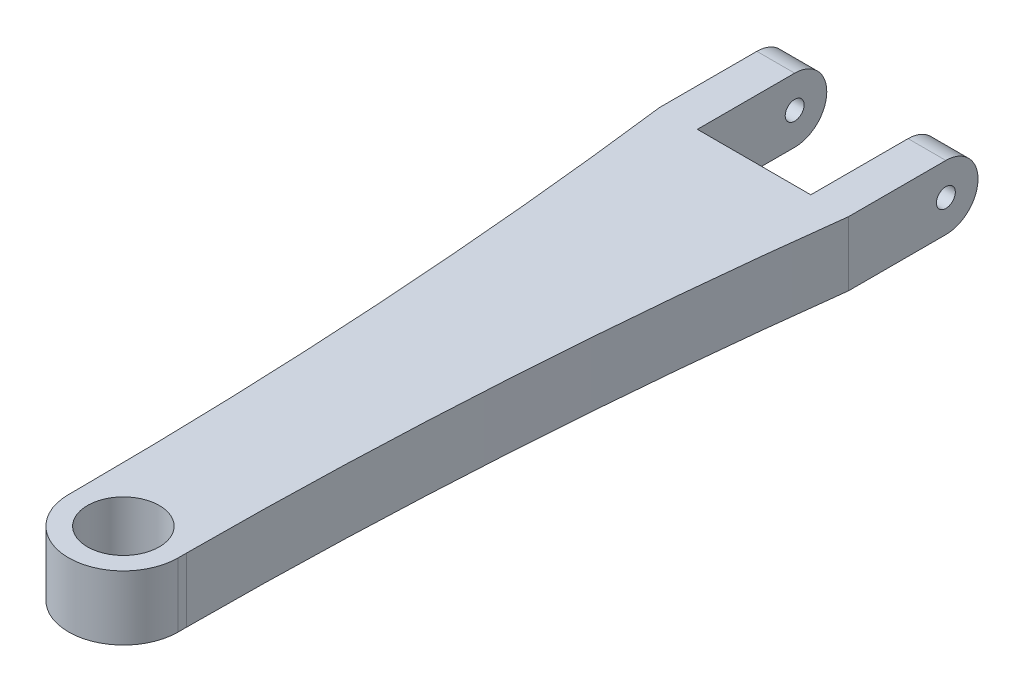
from build123d import *

# Parameters (mm, degrees)
SKETCH1_R               = 12.065
BOSS_EXTRUDE1_DEPTH     = 10.795
SKETCH5_W               = 38.1
SKETCH5_H               = 21.59
BOSS_EXTRUDE2_DEPTH     = 130.488454496
CUT_EXTRUDE2_DEPTH      = 288.61614995
CUT_EXTRUDE2_DEPTH_BACK = 76.454
SKETCH9_W               = 12.7
SKETCH9_H               = 21.59
BOSS_EXTRUDE4_DEPTH     = 117.602
CUT_EXTRUDE3_DEPTH      = 275.951363024
CUT_EXTRUDE3_DEPTH_BACK = 275.951363024
SKETCH6_4_R             = 3.175
CUT_EXTRUDE4_DEPTH      = 259.252608458
SKETCH11_W              = 5.187323944
SKETCH11_H              = 1.989964789
CUT_EXTRUDE7_DEPTH      = 2.54


with BuildPart() as part:
    # Sketch1 → Boss-Extrude1 (new, symmetric)
    with BuildSketch(Plane(origin=(0, 0, 0), x_dir=(1, 0, 0), z_dir=(0, 1, 0))):
        with BuildLine():
            Line((-31.75, 152.4), (31.75, 152.4))
            ThreePointArc((31.75, 152.4), (21.755106695, 76.491146914), (18.415, 0))
            ThreePointArc((18.415, 0), (0, -18.415), (-18.415, 0))
            ThreePointArc((-18.415, 0), (-21.755106695, 76.491146914), (-31.75, 152.4))
        make_face()
        Circle(SKETCH1_R, mode=Mode.SUBTRACT)
    extrude(amount=BOSS_EXTRUDE1_DEPTH, both=True)

    # Sketch5 → Boss-Extrude2 (add)
    with BuildSketch(Plane(origin=(0, 0, -152.4), x_dir=(-1, 0, 0), z_dir=(0, 0, -1))):
        Rectangle(SKETCH5_W, SKETCH5_H)
    extrude(amount=BOSS_EXTRUDE2_DEPTH)

    # Sketch6<3> → Cut-Extrude2 (cut, two sides: drawn at the far end of the back side and taken through both)
    with BuildSketch(Plane(origin=(19.05, 0, 0), x_dir=(0, 0, -1), z_dir=(1, 0, 0)).offset(-CUT_EXTRUDE2_DEPTH_BACK)):
        Polygon((211.893055705, 10.795), (213.781935951, -10.795), (282.888454496, -10.795), (282.888454496, 10.795), align=None)
    extrude(amount=CUT_EXTRUDE2_DEPTH + CUT_EXTRUDE2_DEPTH_BACK, mode=Mode.SUBTRACT)

    # Sketch9 → Boss-Extrude4 (add)
    with BuildSketch(Plane(origin=(0, 0, -152.4), x_dir=(-1, 0, 0), z_dir=(0, 0, -1))):
        with Locations((25.4, 0)):
            Rectangle(SKETCH9_W, SKETCH9_H)
        with Locations((-25.4, 0)):
            Rectangle(SKETCH9_W, SKETCH9_H)
    extrude(amount=BOSS_EXTRUDE4_DEPTH)

    # Sketch6<4> → Cut-Extrude3 (cut, two sides: drawn at the far end of the back side and taken through both)
    with BuildSketch(Plane(origin=(19.05, 0, 0), x_dir=(0, 0, -1), z_dir=(1, 0, 0)).offset(-CUT_EXTRUDE3_DEPTH_BACK)):
        with BuildLine():
            Line((282.888454496, 10.795), (244.587495828, 10.795))
            ThreePointArc((244.587495828, 10.795), (255.382495828, 0), (244.587495828, -10.795))
            Line((244.587495828, -10.795), (282.888454496, -10.795))
            Line((282.888454496, -10.795), (282.888454496, 10.795))
        make_face()
        with Locations((244.587495828, 0)):
            Circle(SKETCH6_4_R)
    extrude(amount=CUT_EXTRUDE3_DEPTH + CUT_EXTRUDE3_DEPTH_BACK, mode=Mode.SUBTRACT)

    # Sketch10 → Cut-Extrude4 (cut, through all)
    with BuildSketch(Plane(origin=(0, 10.795, 0), x_dir=(1, 0, 0), z_dir=(0, 1, 0))):
        with BuildLine():
            Line((-31.75, 211.893055705), (-31.75, 0))
            Line((-31.75, 0), (-18.415, 0))
            ThreePointArc((-18.415, 0), (-21.792855317, 106.153554042), (-31.75, 211.893055705))
        make_face()
        with BuildLine():
            Line((31.75, 0), (18.415, 0))
            ThreePointArc((18.415, 0), (21.792855317, 106.153554042), (31.75, 211.893055705))
            Line((31.75, 211.893055705), (31.75, 0))
        make_face()
    extrude(amount=-CUT_EXTRUDE4_DEPTH, mode=Mode.SUBTRACT)

    # Sketch11 → Cut-Extrude7 (cut)
    # profile 1 of 13: a face of its own
    with BuildSketch(Plane.XZ.offset(10.795)):
        Polygon((-6.35, -62.666908012), (-6.35, -60.341555899), (6.35, -60.341555899), (6.35, -68.393646568), (4.382394366, -68.393646568), (4.382394366, -62.666908012), (1.162676056, -62.666908012), (1.162676056, -67.563562941), (-0.804929577, -67.563562941), (-0.804929577, -62.666908012), align=None)
    # profile 2 of 13: a face of its own
    with BuildSketch(Plane.XZ.offset(10.795)):
        with BuildLine():
            Line((-5.377376761, -75.542986357), (-5.377376761, -75.503857835))
            add(Edge.make_bspline(
                [(-5.377376761, -75.503857835), (-5.523000775, -75.36033513), (-5.741599589, -75.121138963), (-5.993290526, -74.750307116), (-6.188393925, -74.428341526), (-6.343624347, -74.061193712), (-6.499248284, -73.503384161), (-6.522766981, -73.055036767), (-6.528873239, -72.750886885)],
                knots=[0, 0, 0, 0, 0.199682086, 0.314641836, 0.436845726, 0.566325444, 0.702153198, 1, 1, 1, 1], degree=3))
            add(Edge.make_bspline(
                [(-6.528873239, -72.750886885), (-6.534348981, -72.536020084), (-6.500764736, -72.219666618), (-6.425944988, -71.806221024), (-6.337605928, -71.514300981), (-6.230817166, -71.235718964), (-6.094027483, -70.979978414), (-5.945254691, -70.73840068), (-5.766275251, -70.523780442), (-5.571061586, -70.326729325), (-5.35431227, -70.152689964), (-5.118167167, -70.00106113), (-4.863470836, -69.872774179), (-4.591747452, -69.767652732), (-4.198845196, -69.671131267), (-3.891963301, -69.640575015), (-3.683670775, -69.64296435)],
                knots=[0, 0, 0, 0, 0.135753461, 0.201289027, 0.265924895, 0.328744909, 0.390008715, 0.449462135, 0.508198921, 0.566644207, 0.625008926, 0.683964868, 0.744164034, 0.805456281, 0.868173563, 1, 1, 1, 1], degree=3))
            add(Edge.make_bspline(
                [(-3.683670775, -69.64296435), (-3.456156568, -69.643625148), (-3.118669763, -69.671622319), (-2.691839424, -69.789856605), (-2.396678423, -69.910701784), (-2.122840105, -70.062197598), (-1.86870332, -70.239863798), (-1.635436598, -70.443585574), (-1.428372387, -70.678041385), (-1.243818486, -70.936088428), (-1.080730704, -71.217663233), (-0.940530635, -71.523372827), (-0.826895975, -71.853205754), (-0.738826397, -72.204143101), (-0.644561057, -72.705486629), (-0.631020582, -73.096413866), (-0.626056338, -73.360173857)],
                knots=[0, 0, 0, 0, 0.126150634, 0.186107933, 0.24464777, 0.302377155, 0.359057228, 0.416086105, 0.473457026, 0.531873962, 0.591517445, 0.653388754, 0.717839306, 0.784410882, 0.85363079, 1, 1, 1, 1], degree=3))
            add(Edge.make_bspline(
                [(-0.626056338, -73.360173857), (-0.624413187, -73.733158503), (-0.671813539, -74.409193693), (-0.800871678, -75.074085118), (-0.880391725, -75.366908012)],
                knots=[0, 0, 0, 0, 0.551425952, 1, 1, 1, 1], degree=3))
            Line((-0.880391725, -75.366908012), (-0.511465669, -75.366908012))
            add(Edge.make_bspline(
                [(-0.511465669, -75.366908012), (-0.300357842, -75.361455396), (0.022676311, -75.319933432), (0.408452448, -75.127253505), (0.61910918, -74.952385924), (0.767906894, -74.783507968), (0.86463861, -74.633422725), (0.952146934, -74.467158021), (1.027532862, -74.28202301), (1.089389275, -74.076430446), (1.150995481, -73.761993966), (1.161615797, -73.512261395), (1.162676056, -73.340609596)],
                knots=[0, 0, 0, 0, 0.214185065, 0.321340304, 0.430822662, 0.488101748, 0.547781386, 0.610406352, 0.677410811, 0.749051275, 0.826632186, 1, 1, 1, 1], degree=3))
            add(Edge.make_bspline(
                [(1.162676056, -73.340609596), (1.163750396, -72.88474832), (1.103617781, -72.31123122), (0.953794351, -71.629562415), (0.826916507, -71.136220433), (0.712524413, -70.762046259), (0.626056338, -70.509381603)],
                knots=[0, 0, 0, 0, 0.47212599, 0.59466527, 0.723238136, 1, 1, 1, 1], degree=3))
            Line((0.626056338, -70.509381603), (2.333736796, -70.509381603))
            add(Edge.make_bspline(
                [(2.333736796, -70.509381603), (2.536513461, -70.979491858), (2.720634129, -71.600207918), (2.856445509, -72.366637345), (2.930485183, -72.905932424), (2.945548275, -73.318060615), (2.951408451, -73.594944983)],
                knots=[0, 0, 0, 0, 0.484533312, 0.610066216, 0.737401672, 1, 1, 1, 1], degree=3))
            add(Edge.make_bspline(
                [(2.951408451, -73.594944983), (2.954679677, -73.908992017), (2.9240806, -74.366062272), (2.821966282, -74.950634207), (2.716424391, -75.345508895), (2.581176643, -75.707898764), (2.428444071, -76.043141933), (2.245734881, -76.34401221), (2.044212945, -76.616777366), (1.823449811, -76.860217053), (1.577994295, -77.066368928), (1.316722522, -77.24620174), (1.033749136, -77.38737066), (0.735346848, -77.496794385), (0.315470489, -77.602201193), (-0.011714476, -77.633006632), (-0.231976232, -77.633567343)],
                knots=[0, 0, 0, 0, 0.162600675, 0.23662248, 0.307090688, 0.373962725, 0.436786025, 0.497613108, 0.555906724, 0.612258567, 0.667373686, 0.721579263, 0.776178631, 0.830681954, 0.885923677, 1, 1, 1, 1], degree=3))
            Line((-0.231976232, -77.633567343), (-3.652926937, -77.633567343))
            add(Edge.make_bspline(
                [(-3.652926937, -77.633567343), (-3.931528143, -77.629643546), (-4.333955092, -77.637682782), (-4.84918046, -77.643659447), (-5.469716424, -77.660025391), (-5.966205115, -77.678150298), (-6.35, -77.692260124)],
                knots=[0, 0, 0, 0, 0.30976114, 0.447557045, 0.572944586, 1, 1, 1, 1], degree=3))
            Line((-6.35, -77.692260124), (-6.35, -75.638012765))
            Line((-6.35, -75.638012765), (-5.377376761, -75.542986357))
        make_face()
        with BuildLine():
            Line((-3.789876761, -75.366908012), (-2.585277289, -75.366908012))
            add(Edge.make_bspline(
                [(-2.585277289, -75.366908012), (-2.538389902, -75.119504566), (-2.451512268, -74.589476179), (-2.414768227, -74.053185653), (-2.414788732, -73.768228434)],
                knots=[0, 0, 0, 0, 0.469271403, 1, 1, 1, 1], degree=3))
            add(Edge.make_bspline(
                [(-2.414788732, -73.768228434), (-2.416063113, -73.518195998), (-2.443932596, -73.15907743), (-2.570630645, -72.719741368), (-2.702011603, -72.453851668), (-2.868847555, -72.233864724), (-3.162630905, -72.018790386), (-3.438046254, -71.968534831), (-3.619388204, -71.968316462)],
                knots=[0, 0, 0, 0, 0.30772216, 0.439218749, 0.559553598, 0.670424442, 0.775316183, 1, 1, 1, 1], degree=3))
            add(Edge.make_bspline(
                [(-3.619388204, -71.968316462), (-3.790589739, -71.9654023), (-4.042090901, -72.019212147), (-4.315038072, -72.201269389), (-4.474087636, -72.372741573), (-4.594735546, -72.578612909), (-4.712903514, -72.897676082), (-4.738457831, -73.16052626), (-4.740140845, -73.337814702)],
                knots=[0, 0, 0, 0, 0.258055189, 0.374498204, 0.489741314, 0.607497638, 0.731905767, 1, 1, 1, 1], degree=3))
            add(Edge.make_bspline(
                [(-4.740140845, -73.337814702), (-4.742789055, -73.557976374), (-4.694802944, -73.880738366), (-4.556083585, -74.280791136), (-4.431633387, -74.551634364), (-4.283837668, -74.795535263), (-4.083416219, -75.077521193), (-3.906719961, -75.257582978), (-3.789876761, -75.366908012)],
                knots=[0, 0, 0, 0, 0.285977089, 0.420604808, 0.550296036, 0.673226679, 0.791379641, 1, 1, 1, 1], degree=3))
        make_face(mode=Mode.SUBTRACT)
    # profile 3 of 13: a face of its own
    with BuildSketch(Plane.XZ.offset(10.795)):
        with BuildLine():
            Line((-3.736773768, -80.733105195), (0.983802817, -80.733105195))
            Line((0.983802817, -80.733105195), (0.983802817, -79.025424737))
            Line((0.983802817, -79.025424737), (2.772535211, -79.025424737))
            Line((2.772535211, -79.025424737), (2.772535211, -80.733105195))
            Line((2.772535211, -80.733105195), (5.276760563, -80.733105195))
            Line((5.276760563, -80.733105195), (5.276760563, -83.058457307))
            Line((5.276760563, -83.058457307), (2.772535211, -83.058457307))
            Line((2.772535211, -83.058457307), (2.772535211, -85.699632483))
            Line((2.772535211, -85.699632483), (0.983802817, -85.699632483))
            Line((0.983802817, -85.699632483), (0.983802817, -83.058457307))
            Line((0.983802817, -83.058457307), (-3.510387324, -83.058457307))
            add(Edge.make_bspline(
                [(-3.510387324, -83.058457307), (-3.665120027, -83.062913164), (-3.939300523, -83.071184843), (-4.20112758, -83.156748148), (-4.30134243, -83.217766286)],
                knots=[0, 0, 0, 0, 0.571249626, 1, 1, 1, 1], degree=3))
            add(Edge.make_bspline(
                [(-4.30134243, -83.217766286), (-4.376384378, -83.263464438), (-4.474179278, -83.356657263), (-4.573963551, -83.509048884), (-4.63532274, -83.641947847), (-4.683171756, -83.792133253), (-4.727160789, -84.026268266), (-4.743997016, -84.211992105), (-4.740140845, -84.341313821)],
                knots=[0, 0, 0, 0, 0.208419765, 0.317471664, 0.432748722, 0.55639055, 0.692313449, 1, 1, 1, 1], degree=3))
            add(Edge.make_bspline(
                [(-4.740140845, -84.341313821), (-4.738128583, -84.598486376), (-4.698722962, -85.101818338), (-4.585817515, -85.593470433), (-4.522139085, -85.830992519)],
                knots=[0, 0, 0, 0, 0.51106835, 1, 1, 1, 1], degree=3))
            Line((-4.522139085, -85.830992519), (-6.294102113, -85.830992519))
            add(Edge.make_bspline(
                [(-6.294102113, -85.830992519), (-6.376995629, -85.536389773), (-6.489128222, -84.912184346), (-6.524194359, -84.279564169), (-6.528873239, -83.952823504)],
                knots=[0, 0, 0, 0, 0.483324485, 1, 1, 1, 1], degree=3))
            add(Edge.make_bspline(
                [(-6.528873239, -83.952823504), (-6.529403958, -83.598469238), (-6.494139516, -83.084319518), (-6.331754484, -82.445955044), (-6.171130687, -82.036410727), (-5.96339485, -81.681073613), (-5.635638368, -81.280906735), (-5.317751068, -81.062212119), (-5.089502641, -80.959491638)],
                knots=[0, 0, 0, 0, 0.302824136, 0.436649626, 0.560811872, 0.676986647, 0.786518558, 1, 1, 1, 1], degree=3))
            add(Edge.make_bspline(
                [(-5.089502641, -80.959491638), (-4.901931138, -80.878241677), (-4.455217678, -80.754462206), (-3.992371965, -80.735135186), (-3.736773768, -80.733105195)],
                knots=[0, 0, 0, 0, 0.44344314, 1, 1, 1, 1], degree=3))
        make_face()
    # profile 4 of 13: a face of its own
    with BuildSketch(Plane.XZ.offset(10.795)):
        with BuildLine():
            Line((1.528807218, -89.752229314), (1.528807218, -89.791357835))
            add(Edge.make_bspline(
                [(1.528807218, -89.791357835), (1.720760174, -89.935609053), (1.988467231, -90.193516455), (2.310127299, -90.579794212), (2.522445125, -90.919294804), (2.700481841, -91.295655962), (2.894291642, -91.878726633), (2.955362566, -92.355207959), (2.951408451, -92.684073504)],
                knots=[0, 0, 0, 0, 0.214935507, 0.332555904, 0.450128772, 0.573137885, 0.705297303, 1, 1, 1, 1], degree=3))
            add(Edge.make_bspline(
                [(2.951408451, -92.684073504), (2.950327961, -92.981985239), (2.910527196, -93.42633912), (2.756763865, -93.99126285), (2.59610136, -94.386514803), (2.376961496, -94.748930743), (2.010207631, -95.195257769), (1.649328172, -95.453019467), (1.386267606, -95.585173857)],
                knots=[0, 0, 0, 0, 0.257141535, 0.382089427, 0.503852493, 0.623877236, 0.745995042, 1, 1, 1, 1], degree=3))
            add(Edge.make_bspline(
                [(1.386267606, -95.585173857), (1.132236509, -95.711422067), (0.783135498, -95.82641204), (0.337154374, -95.892987032), (-0.028117019, -95.926674219), (-0.314660499, -95.938174374), (-0.514260563, -95.937330547)],
                knots=[0, 0, 0, 0, 0.436009756, 0.559217828, 0.693095009, 1, 1, 1, 1], degree=3))
            Line((-0.514260563, -95.937330547), (-6.35, -95.937330547))
            Line((-6.35, -95.937330547), (-6.35, -93.611978434))
            Line((-6.35, -93.611978434), (-0.757416373, -93.611978434))
            add(Edge.make_bspline(
                [(-0.757416373, -93.611978434), (-0.52662467, -93.609163042), (-0.12943691, -93.608868332), (0.25647615, -93.512271764), (0.405259683, -93.444284772)],
                knots=[0, 0, 0, 0, 0.586908571, 1, 1, 1, 1], degree=3))
            add(Edge.make_bspline(
                [(0.405259683, -93.444284772), (0.533519101, -93.382639677), (0.714162022, -93.269096546), (0.89629601, -93.059997178), (0.997977042, -92.885587831), (1.071614009, -92.695247912), (1.145124592, -92.418656962), (1.16056812, -92.200113776), (1.162676056, -92.052427378)],
                knots=[0, 0, 0, 0, 0.254536988, 0.373413235, 0.491030264, 0.61252201, 0.736173378, 1, 1, 1, 1], degree=3))
            add(Edge.make_bspline(
                [(1.162676056, -92.052427378), (1.158966203, -91.843802346), (1.123054548, -91.531521841), (0.989203271, -91.137811173), (0.85353348, -90.857232566), (0.684776987, -90.586661553), (0.40311117, -90.233888986), (0.146844235, -90.000126183), (-0.039128521, -89.855640406)],
                knots=[0, 0, 0, 0, 0.241565862, 0.359750787, 0.47921944, 0.601148452, 0.727639612, 1, 1, 1, 1], degree=3))
            Line((-0.039128521, -89.855640406), (-6.35, -89.855640406))
            Line((-6.35, -89.855640406), (-6.35, -87.530288293))
            Line((-6.35, -87.530288293), (7.244366197, -87.530288293))
            Line((7.244366197, -87.530288293), (7.244366197, -89.855640406))
            Line((7.244366197, -89.855640406), (3.518772007, -89.855640406))
            add(Edge.make_bspline(
                [(3.518772007, -89.855640406), (3.303621947, -89.851091556), (2.996917187, -89.856224194), (2.60856875, -89.841518229), (2.159094115, -89.829174137), (1.80167679, -89.795959009), (1.528807218, -89.752229314)],
                knots=[0, 0, 0, 0, 0.323698578, 0.461084416, 0.584465162, 1, 1, 1, 1], degree=3))
        make_face()
    # profile 5 of 13: a face of its own
    with BuildSketch(Plane.XZ.offset(10.795)):
        with BuildLine():
            Line((-4.203521127, -105.635613997), (-5.99784331, -105.635613997))
            add(Edge.make_bspline(
                [(-5.99784331, -105.635613997), (-6.077649215, -105.458453484), (-6.167345051, -105.1532888), (-6.278720826, -104.706729941), (-6.362665921, -104.295555802), (-6.438283972, -103.851373346), (-6.508911486, -103.232043995), (-6.527479586, -102.761881255), (-6.528873239, -102.446639526)],
                knots=[0, 0, 0, 0, 0.178834163, 0.293140233, 0.424870548, 0.566116854, 0.708959156, 1, 1, 1, 1], degree=3))
            add(Edge.make_bspline(
                [(-6.528873239, -102.446639526), (-6.524662912, -102.131319639), (-6.502320897, -101.661257984), (-6.393427639, -101.050100669), (-6.29042973, -100.608605375), (-6.149824601, -100.186862328), (-5.967040188, -99.793653518), (-5.748170793, -99.430640857), (-5.49135924, -99.09675923), (-5.194199535, -98.794325863), (-4.855789316, -98.523603419), (-4.475770598, -98.289425087), (-4.056431914, -98.085974661), (-3.591782327, -97.923456074), (-2.885098692, -97.76267825), (-2.322930636, -97.725383297), (-1.936861796, -97.726062941)],
                knots=[0, 0, 0, 0, 0.126201017, 0.187427139, 0.247946949, 0.30730283, 0.364786734, 0.420927941, 0.476423112, 0.53278007, 0.590011285, 0.649225629, 0.710854779, 0.775989482, 0.845550806, 1, 1, 1, 1], degree=3))
            add(Edge.make_bspline(
                [(-1.936861796, -97.726062941), (-1.551391684, -97.723994022), (-0.987743518, -97.766725066), (-0.272258689, -97.921278062), (0.20956217, -98.081777329), (0.649958669, -98.28190242), (1.057402565, -98.505761084), (1.418483701, -98.77135688), (1.741498658, -99.063528971), (2.028737941, -99.379847517), (2.274482595, -99.722079284), (2.484045801, -100.086093475), (2.652541394, -100.471217819), (2.786237314, -100.868759641), (2.915394729, -101.410986904), (2.94915676, -101.827743194), (2.951408451, -102.105662413)],
                knots=[0, 0, 0, 0, 0.156882612, 0.229107997, 0.297459654, 0.36314538, 0.425796905, 0.486323791, 0.545120152, 0.602845335, 0.659887668, 0.716282239, 0.77349699, 0.83069666, 0.886803641, 1, 1, 1, 1], degree=3))
            add(Edge.make_bspline(
                [(2.951408451, -102.105662413), (2.95179406, -102.389056199), (2.920174064, -102.809105834), (2.807204284, -103.350224475), (2.690984536, -103.732202092), (2.535778211, -104.091651112), (2.347359526, -104.430593329), (2.110534971, -104.7383792), (1.843393532, -105.026137305), (1.531440111, -105.281970933), (1.180659459, -105.508434051), (0.788148984, -105.705332363), (0.354268014, -105.868798433), (-0.12072798, -106.000362442), (-0.833428604, -106.13075925), (-1.394858525, -106.1588737), (-1.780347711, -106.161054138)],
                knots=[0, 0, 0, 0, 0.119879172, 0.177458127, 0.233549327, 0.288449864, 0.342803166, 0.397106446, 0.452304595, 0.508563044, 0.567259857, 0.628589586, 0.693946078, 0.763071654, 0.836808316, 1, 1, 1, 1], degree=3))
            add(Edge.make_bspline(
                [(-1.780347711, -106.161054138), (-2.187287943, -106.155119775), (-2.593661972, -106.133105195)],
                knots=[0, 0, 0, 1, 1, 1], degree=2))
            Line((-2.593661972, -106.133105195), (-2.593661972, -99.948003962))
            add(Edge.make_bspline(
                [(-2.593661972, -99.948003962), (-2.774903938, -99.96319537), (-3.037978121, -100.007911676), (-3.367292094, -100.117915981), (-3.585218885, -100.224725812), (-3.783005137, -100.351517662), (-3.96061758, -100.497692237), (-4.11724294, -100.663672035), (-4.25554673, -100.84622579), (-4.372124323, -101.047527348), (-4.477167832, -101.262205722), (-4.559450589, -101.495336489), (-4.700806575, -102.014664254), (-4.73499147, -102.474239762), (-4.740140845, -102.843514526)],
                knots=[0, 0, 0, 0, 0.135126454, 0.197295241, 0.257354931, 0.314959002, 0.371505257, 0.427813743, 0.48416051, 0.541263303, 0.600398386, 0.661490357, 0.724630411, 1, 1, 1, 1], degree=3))
            add(Edge.make_bspline(
                [(-4.740140845, -102.843514526), (-4.737390261, -103.299494273), (-4.633886834, -104.250047657), (-4.365003046, -105.166853639), (-4.203521127, -105.635613997)],
                knots=[0, 0, 0, 0, 0.47870666, 1, 1, 1, 1], degree=3))
        make_face()
        with BuildLine():
            Line((-0.804929577, -100.051415054), (-0.804929577, -103.807753082))
            add(Edge.make_bspline(
                [(-0.804929577, -103.807753082), (-0.54803484, -103.806313397), (-0.164627085, -103.760332842), (0.293592954, -103.564944145), (0.592536635, -103.371466822), (0.836049125, -103.11573763), (0.987888011, -102.859589809), (1.080932495, -102.63422713), (1.144317388, -102.375758748), (1.16637762, -102.173016902), (1.162676056, -102.032995159)],
                knots=[0, 0, 0, 0, 0.25925941, 0.381419877, 0.498352412, 0.614980527, 0.733078308, 0.795710646, 0.859564382, 1, 1, 1, 1], degree=3))
            add(Edge.make_bspline(
                [(1.162676056, -102.032995159), (1.16653727, -101.891968517), (1.143329843, -101.686786946), (1.081139373, -101.42340093), (0.985877416, -101.188317154), (0.837705168, -100.914307595), (0.590400371, -100.637976568), (0.298199411, -100.407902622), (-0.163346474, -100.180612936), (-0.54334646, -100.084247305), (-0.804929577, -100.051415054)],
                knots=[0, 0, 0, 0, 0.136895013, 0.200489877, 0.262829713, 0.383472697, 0.50176953, 0.621370873, 0.743505761, 1, 1, 1, 1], degree=3))
        make_face(mode=Mode.SUBTRACT)
    # profile 6 of 13: a face of its own
    with BuildSketch(Plane.XZ.offset(10.795)):
        with BuildLine():
            Line((1.162676056, -113.623422096), (1.162676056, -113.433369279))
            add(Edge.make_bspline(
                [(1.162676056, -113.433369279), (1.163211888, -113.109248321), (1.122367424, -112.635518596), (0.97443024, -112.03423534), (0.818079731, -111.629751913), (0.62008708, -111.258769861), (0.28935141, -110.819806206), (-0.036534867, -110.56401406), (-0.271104754, -110.426062941)],
                knots=[0, 0, 0, 0, 0.278265096, 0.406110199, 0.53044139, 0.649625591, 0.766089288, 1, 1, 1, 1], degree=3))
            Line((-0.271104754, -110.426062941), (-6.35, -110.426062941))
            Line((-6.35, -110.426062941), (-6.35, -108.100710828))
            Line((-6.35, -108.100710828), (2.772535211, -108.100710828))
            Line((2.772535211, -108.100710828), (2.772535211, -110.029187941))
            Line((2.772535211, -110.029187941), (1.461729754, -110.247189702))
            Line((1.461729754, -110.247189702), (1.461729754, -110.283523328))
            add(Edge.make_bspline(
                [(1.461729754, -110.283523328), (1.68291063, -110.417590265), (2.00580021, -110.644228978), (2.340491022, -111.044331908), (2.561417561, -111.371857259), (2.740165731, -111.737278992), (2.905651094, -112.292439739), (2.953198864, -112.735767779), (2.951408451, -113.039289173)],
                knots=[0, 0, 0, 0, 0.236871689, 0.354320957, 0.473743378, 0.596430905, 0.723496548, 1, 1, 1, 1], degree=3))
            add(Edge.make_bspline(
                [(2.951408451, -113.039289173), (2.954192543, -113.332530441), (2.917869718, -113.623422096)],
                knots=[0, 0, 0, 1, 1, 1], degree=2))
            Line((2.917869718, -113.623422096), (1.162676056, -113.623422096))
        make_face()
    # profile 7 of 13: a face of its own
    with BuildSketch(Plane.XZ.offset(10.795)):
        with BuildLine():
            Line((2.456712148, -121.015917695), (0.626056338, -121.015917695))
            add(Edge.make_bspline(
                [(0.626056338, -121.015917695), (0.70742196, -120.801877229), (0.805100541, -120.466588452), (0.928267125, -120.014657696), (1.001918768, -119.663255254), (1.067169633, -119.313098337), (1.131177006, -118.859054107), (1.165927562, -118.521287864), (1.162676056, -118.299280371)],
                knots=[0, 0, 0, 0, 0.246773815, 0.376734394, 0.505287754, 0.634041406, 0.760993002, 1, 1, 1, 1], degree=3))
            add(Edge.make_bspline(
                [(1.162676056, -118.299280371), (1.162967774, -118.075256241), (1.136820421, -117.760242528), (1.012794305, -117.391006359), (0.899741998, -117.189939245), (0.765004101, -117.034429322), (0.553627085, -116.90571075), (0.376546734, -116.865982734), (0.259925176, -116.865499561)],
                knots=[0, 0, 0, 0, 0.355425938, 0.494403848, 0.613294326, 0.718739884, 0.816122949, 1, 1, 1, 1], degree=3))
            add(Edge.make_bspline(
                [(0.259925176, -116.865499561), (0.165168783, -116.862313852), (0.028558931, -116.882817382), (-0.139270757, -116.948033898), (-0.281405491, -117.043755316), (-0.434250809, -117.210627276), (-0.56818338, -117.461484516), (-0.671229832, -117.744759072), (-0.792230798, -118.136759867), (-0.860541914, -118.43777364), (-0.913930458, -118.634667695)],
                knots=[0, 0, 0, 0, 0.12262133, 0.177451452, 0.232494819, 0.343785443, 0.467317434, 0.599463407, 0.734963276, 1, 1, 1, 1], degree=3))
            add(Edge.make_bspline(
                [(-0.913930458, -118.634667695), (-0.992176085, -118.93811864), (-1.117371574, -119.389734115), (-1.358288596, -119.965010572), (-1.573327491, -120.285948213), (-1.774779065, -120.517399031), (-1.950728796, -120.671507791), (-2.146424733, -120.810950863), (-2.363118713, -120.935695405), (-2.605892376, -121.038951434), (-2.989657989, -121.132357222), (-3.296479847, -121.161218617), (-3.510387324, -121.158457307)],
                knots=[0, 0, 0, 0, 0.235459101, 0.351725582, 0.466842381, 0.523864189, 0.58187405, 0.642084369, 0.704157612, 0.769412783, 0.839524744, 1, 1, 1, 1], degree=3))
            add(Edge.make_bspline(
                [(-3.510387324, -121.158457307), (-3.75084684, -121.159488507), (-4.103293863, -121.122088088), (-4.546993085, -120.993947425), (-4.844845152, -120.857924475), (-5.118979383, -120.68873592), (-5.367640133, -120.486577621), (-5.593568195, -120.254856856), (-5.794957784, -119.99406032), (-5.971005507, -119.704891362), (-6.121605363, -119.389610946), (-6.250094343, -119.051348869), (-6.353709493, -118.68948228), (-6.428804763, -118.307529), (-6.511458109, -117.76765445), (-6.52731177, -117.351124884), (-6.528873239, -117.06952685)],
                knots=[0, 0, 0, 0, 0.125855407, 0.184365257, 0.24113851, 0.296787386, 0.352641216, 0.40853552, 0.46591976, 0.524828999, 0.585494137, 0.648652749, 0.71413013, 0.782354753, 0.852390659, 1, 1, 1, 1], degree=3))
            add(Edge.make_bspline(
                [(-6.528873239, -117.06952685), (-6.532256341, -116.79412022), (-6.5096232, -116.391864344), (-6.455740299, -115.870781473), (-6.393787706, -115.513659161), (-6.31730915, -115.18349907), (-6.216884552, -114.795939895), (-6.115667331, -114.52703769), (-6.039766725, -114.361274209)],
                knots=[0, 0, 0, 0, 0.297874603, 0.435855396, 0.566829643, 0.689885267, 0.802655885, 1, 1, 1, 1], degree=3))
            Line((-6.039766725, -114.361274209), (-4.203521127, -114.361274209))
            add(Edge.make_bspline(
                [(-4.203521127, -114.361274209), (-4.30229691, -114.592359859), (-4.42767227, -114.937101764), (-4.560665316, -115.393637599), (-4.690532258, -115.992947042), (-4.73657351, -116.490744556), (-4.740140845, -116.879474033)],
                knots=[0, 0, 0, 0, 0.290731084, 0.424175831, 0.55001595, 1, 1, 1, 1], degree=3))
            add(Edge.make_bspline(
                [(-4.740140845, -116.879474033), (-4.739864024, -117.138235234), (-4.719095616, -117.512535938), (-4.614518171, -117.977596059), (-4.501526791, -118.265775544), (-4.352568503, -118.504040894), (-4.196956622, -118.660769792), (-4.055457836, -118.753113155), (-3.894260352, -118.812105643), (-3.766979377, -118.837716833), (-3.678080986, -118.833105195)],
                knots=[0, 0, 0, 0, 0.314780777, 0.453182003, 0.57763785, 0.689127118, 0.792398441, 0.843280849, 0.893106937, 1, 1, 1, 1], degree=3))
            add(Edge.make_bspline(
                [(-3.678080986, -118.833105195), (-3.590103611, -118.829382596), (-3.458202008, -118.818006313), (-3.301962904, -118.747749422), (-3.168451666, -118.649246762), (-3.019182206, -118.48942983), (-2.882998151, -118.245042155), (-2.766914491, -117.961451758), (-2.635053279, -117.520515423), (-2.546772299, -117.17379688), (-2.487455986, -116.93537192)],
                knots=[0, 0, 0, 0, 0.110146159, 0.160863683, 0.210596307, 0.315300106, 0.429325168, 0.555802258, 0.695135189, 1, 1, 1, 1], degree=3))
            add(Edge.make_bspline(
                [(-2.487455986, -116.93537192), (-2.394926348, -116.631391227), (-2.264866356, -116.177001962), (-1.998987123, -115.619364833), (-1.785729579, -115.315069226), (-1.586323026, -115.103649842), (-1.419323665, -114.960970098), (-1.23265389, -114.83797023), (-1.029562842, -114.729941742), (-0.804156785, -114.642148841), (-0.457776037, -114.558826866), (-0.181527462, -114.53905451), (0.008384683, -114.540147448)],
                knots=[0, 0, 0, 0, 0.251385219, 0.371833556, 0.48637374, 0.543110701, 0.601056372, 0.659425673, 0.719333199, 0.782466506, 0.849928472, 1, 1, 1, 1], degree=3))
            add(Edge.make_bspline(
                [(0.008384683, -114.540147448), (0.243855212, -114.544504521), (0.593008794, -114.568139772), (1.026428884, -114.699822343), (1.317536944, -114.830070775), (1.584268692, -114.989425028), (1.825633798, -115.178947027), (2.045346309, -115.391487798), (2.238095045, -115.63138493), (2.408324496, -115.890752471), (2.554426522, -116.170057664), (2.677046916, -116.466817896), (2.776869512, -116.779293277), (2.854542906, -117.102631739), (2.929894148, -117.546309301), (2.951134512, -117.885031873), (2.951408451, -118.112022448)],
                knots=[0, 0, 0, 0, 0.136322678, 0.199738465, 0.260360244, 0.319898052, 0.378484798, 0.437009893, 0.495845051, 0.555615241, 0.615710696, 0.677388038, 0.740609979, 0.804739025, 0.869056938, 1, 1, 1, 1], degree=3))
            add(Edge.make_bspline(
                [(2.951408451, -118.112022448), (2.950176842, -118.383274234), (2.938285967, -118.785561137), (2.875870757, -119.310179181), (2.818298638, -119.68427229), (2.74500935, -120.042065153), (2.635973149, -120.487915027), (2.534857703, -120.810016077), (2.456712148, -121.015917695)],
                knots=[0, 0, 0, 0, 0.274971999, 0.407041084, 0.535068094, 0.658355187, 0.776942064, 1, 1, 1, 1], degree=3))
        make_face()
    # profile 8 of 13: a face of its own
    with BuildSketch(Plane.XZ.offset(10.795)):
        with BuildLine():
            Line((-6.35, -127.240147448), (6.35, -127.240147448))
            Line((6.35, -127.240147448), (6.35, -130.649918575))
            add(Edge.make_bspline(
                [(6.35, -130.649918575), (6.352401126, -130.957614184), (6.336067674, -131.41937187), (6.288709701, -132.030393899), (6.237999682, -132.478579326), (6.176990552, -132.914081917), (6.08055871, -133.457144278), (5.985106358, -133.851892678), (5.902816901, -134.101613117)],
                knots=[0, 0, 0, 0, 0.264241714, 0.396690221, 0.526331298, 0.651611411, 0.7743639, 1, 1, 1, 1], degree=3))
            add(Edge.make_bspline(
                [(5.902816901, -134.101613117), (5.795136142, -134.430981425), (5.619127947, -134.915399707), (5.297106232, -135.50955694), (5.038468563, -135.922519442), (4.75028627, -136.303078649), (4.435449417, -136.651159253), (4.097200814, -136.968693698), (3.731692971, -137.250713418), (3.345754748, -137.504026009), (2.935761758, -137.720933099), (2.506143178, -137.910840764), (2.05293437, -138.062831059), (1.579601975, -138.184447748), (0.91072037, -138.294838363), (0.39635123, -138.333425524), (0.047513204, -138.330288293)],
                knots=[0, 0, 0, 0, 0.133631804, 0.197502107, 0.259897886, 0.321093303, 0.381029999, 0.440416757, 0.499467825, 0.558565721, 0.617941645, 0.677854723, 0.739222309, 0.801774613, 0.865816925, 1, 1, 1, 1], degree=3))
            add(Edge.make_bspline(
                [(0.047513204, -138.330288293), (-0.28430138, -138.333840239), (-0.775276696, -138.299241914), (-1.416384532, -138.208588751), (-1.873991432, -138.10707874), (-2.313473992, -137.976524072), (-2.73338197, -137.813417744), (-3.135027968, -137.623509297), (-3.516077437, -137.402679836), (-3.875336197, -137.149255695), (-4.214501549, -136.866836353), (-4.531049622, -136.55227955), (-4.825410244, -136.207966025), (-5.095333755, -135.830070995), (-5.428594365, -135.273156428), (-5.627860652, -134.818430385), (-5.743507923, -134.504077906)],
                knots=[0, 0, 0, 0, 0.133477506, 0.197937946, 0.260560077, 0.32204026, 0.382372043, 0.441774098, 0.50077679, 0.559476979, 0.618604762, 0.67829044, 0.738959515, 0.80079804, 0.865070446, 1, 1, 1, 1], degree=3))
            add(Edge.make_bspline(
                [(-5.743507923, -134.504077906), (-5.850539013, -134.218443633), (-5.983589514, -133.769068765), (-6.11732505, -133.144049711), (-6.204290199, -132.636982176), (-6.272106614, -132.098996611), (-6.328469378, -131.317893833), (-6.3552807, -130.715650757), (-6.35, -130.303351673)],
                knots=[0, 0, 0, 0, 0.214411906, 0.329042931, 0.44935998, 0.576136384, 0.710206617, 1, 1, 1, 1], degree=3))
            Line((-6.35, -130.303351673), (-6.35, -127.240147448))
        make_face()
        with BuildLine():
            Line((4.382394366, -130.599610476), (4.382394366, -129.565499561))
            Line((4.382394366, -129.565499561), (-4.382394366, -129.565499561))
            Line((-4.382394366, -129.565499561), (-4.382394366, -130.532533012))
            add(Edge.make_bspline(
                [(-4.382394366, -130.532533012), (-4.381151344, -130.856860357), (-4.370179064, -131.330666707), (-4.30834894, -131.941446242), (-4.24749011, -132.358453879), (-4.170309251, -132.746905477), (-4.046293589, -133.214008975), (-3.92650113, -133.544787375), (-3.826210387, -133.749456427)],
                knots=[0, 0, 0, 0, 0.295852076, 0.431605319, 0.559553661, 0.680006576, 0.792513711, 1, 1, 1, 1], degree=3))
            add(Edge.make_bspline(
                [(-3.826210387, -133.749456427), (-3.748184803, -133.918280698), (-3.604162615, -134.15363389), (-3.391610362, -134.450403216), (-3.2143538, -134.650198978), (-3.026113064, -134.837632244), (-2.821428749, -135.006248106), (-2.6060123, -135.165453008), (-2.373160336, -135.304052894), (-2.12539126, -135.429212992), (-1.859522141, -135.532773703), (-1.579804582, -135.627667734), (-1.281663975, -135.697580232), (-0.96881872, -135.758503089), (-0.51736888, -135.808285352), (-0.170076847, -135.827577623), (0.067077465, -135.826062941)],
                knots=[0, 0, 0, 0, 0.118882575, 0.176559242, 0.233677013, 0.28982555, 0.346621035, 0.403463569, 0.461313013, 0.520052101, 0.581138163, 0.644007041, 0.70916716, 0.777198731, 0.848141293, 1, 1, 1, 1], degree=3))
            add(Edge.make_bspline(
                [(0.067077465, -135.826062941), (0.313360434, -135.823980003), (0.674483909, -135.808544259), (1.139972056, -135.736043727), (1.461074314, -135.660390945), (1.766300842, -135.565737948), (2.051640484, -135.447273145), (2.323826312, -135.316993306), (2.575797925, -135.162248586), (2.809477116, -134.98800519), (3.030444927, -134.801690379), (3.228291314, -134.591868522), (3.413763779, -134.368853981), (3.581022726, -134.127950062), (3.784256623, -133.78336948), (3.914206075, -133.509877701), (3.985519366, -133.319042695)],
                knots=[0, 0, 0, 0, 0.148227475, 0.216860422, 0.283052715, 0.346498398, 0.408828175, 0.468722568, 0.527825371, 0.586327452, 0.64394532, 0.701410398, 0.759524758, 0.818283898, 0.877577647, 1, 1, 1, 1], degree=3))
            add(Edge.make_bspline(
                [(3.985519366, -133.319042695), (4.132989275, -132.926965697), (4.254799075, -132.403380049), (4.331799991, -131.750824137), (4.374812599, -131.24989279), (4.381166666, -130.863300936), (4.382394366, -130.599610476)],
                knots=[0, 0, 0, 0, 0.454150206, 0.580522118, 0.713528149, 1, 1, 1, 1], degree=3))
        make_face(mode=Mode.SUBTRACT)
    # profile 9 of 13: a face of its own
    with BuildSketch(Plane.XZ.offset(10.795)):
        with BuildLine():
            Line((-5.377376761, -145.661296216), (-5.377376761, -145.622167695))
            add(Edge.make_bspline(
                [(-5.377376761, -145.622167695), (-5.523000775, -145.478644989), (-5.741599589, -145.239448822), (-5.993290526, -144.868616975), (-6.188393925, -144.546651385), (-6.343624347, -144.179503571), (-6.499248284, -143.62169402), (-6.522766981, -143.173346626), (-6.528873239, -142.869196744)],
                knots=[0, 0, 0, 0, 0.199682086, 0.314641836, 0.436845726, 0.566325444, 0.702153198, 1, 1, 1, 1], degree=3))
            add(Edge.make_bspline(
                [(-6.528873239, -142.869196744), (-6.534348981, -142.654329943), (-6.500764736, -142.337976478), (-6.425944988, -141.924530883), (-6.337605928, -141.63261084), (-6.230817166, -141.354028823), (-6.094027483, -141.098288273), (-5.945254691, -140.856710539), (-5.766275251, -140.642090301), (-5.571061586, -140.445039184), (-5.35431227, -140.270999823), (-5.118167167, -140.119370989), (-4.863470836, -139.991084038), (-4.591747452, -139.885962591), (-4.198845196, -139.789441126), (-3.891963301, -139.758884874), (-3.683670775, -139.761274209)],
                knots=[0, 0, 0, 0, 0.135753461, 0.201289027, 0.265924895, 0.328744909, 0.390008715, 0.449462135, 0.508198921, 0.566644207, 0.625008926, 0.683964868, 0.744164034, 0.805456281, 0.868173563, 1, 1, 1, 1], degree=3))
            add(Edge.make_bspline(
                [(-3.683670775, -139.761274209), (-3.456156568, -139.761935007), (-3.118669763, -139.789932178), (-2.691839424, -139.908166464), (-2.396678423, -140.029011644), (-2.122840105, -140.180507457), (-1.86870332, -140.358173657), (-1.635436598, -140.561895433), (-1.428372387, -140.796351244), (-1.243818486, -141.054398287), (-1.080730704, -141.335973092), (-0.940530635, -141.641682686), (-0.826895975, -141.971515613), (-0.738826397, -142.32245296), (-0.644561057, -142.823796488), (-0.631020582, -143.214723726), (-0.626056338, -143.478483716)],
                knots=[0, 0, 0, 0, 0.126150634, 0.186107933, 0.24464777, 0.302377155, 0.359057228, 0.416086105, 0.473457026, 0.531873962, 0.591517445, 0.653388754, 0.717839306, 0.784410882, 0.85363079, 1, 1, 1, 1], degree=3))
            add(Edge.make_bspline(
                [(-0.626056338, -143.478483716), (-0.624413187, -143.851468363), (-0.671813539, -144.527503552), (-0.800871678, -145.192394977), (-0.880391725, -145.485217871)],
                knots=[0, 0, 0, 0, 0.551425952, 1, 1, 1, 1], degree=3))
            Line((-0.880391725, -145.485217871), (-0.511465669, -145.485217871))
            add(Edge.make_bspline(
                [(-0.511465669, -145.485217871), (-0.300357842, -145.479765255), (0.022676311, -145.438243291), (0.408452448, -145.245563364), (0.61910918, -145.070695783), (0.767906894, -144.901817827), (0.86463861, -144.751732584), (0.952146934, -144.58546788), (1.027532862, -144.400332869), (1.089389275, -144.194740305), (1.150995481, -143.880303825), (1.161615797, -143.630571254), (1.162676056, -143.458919455)],
                knots=[0, 0, 0, 0, 0.214185065, 0.321340304, 0.430822662, 0.488101748, 0.547781386, 0.610406352, 0.677410811, 0.749051275, 0.826632186, 1, 1, 1, 1], degree=3))
            add(Edge.make_bspline(
                [(1.162676056, -143.458919455), (1.163750396, -143.003058179), (1.103617781, -142.429541079), (0.953794351, -141.747872274), (0.826916507, -141.254530292), (0.712524413, -140.880356119), (0.626056338, -140.627691462)],
                knots=[0, 0, 0, 0, 0.47212599, 0.59466527, 0.723238136, 1, 1, 1, 1], degree=3))
            Line((0.626056338, -140.627691462), (2.333736796, -140.627691462))
            add(Edge.make_bspline(
                [(2.333736796, -140.627691462), (2.536513461, -141.097801718), (2.720634129, -141.718517777), (2.856445509, -142.484947204), (2.930485183, -143.024242283), (2.945548275, -143.436370475), (2.951408451, -143.713254843)],
                knots=[0, 0, 0, 0, 0.484533312, 0.610066216, 0.737401672, 1, 1, 1, 1], degree=3))
            add(Edge.make_bspline(
                [(2.951408451, -143.713254843), (2.954679677, -144.027301876), (2.9240806, -144.484372131), (2.821966282, -145.068944066), (2.716424391, -145.463818754), (2.581176643, -145.826208623), (2.428444071, -146.161451792), (2.245734881, -146.46232207), (2.044212945, -146.735087226), (1.823449811, -146.978526912), (1.577994295, -147.184678787), (1.316722522, -147.364511599), (1.033749136, -147.505680519), (0.735346848, -147.615104244), (0.315470489, -147.720511052), (-0.011714476, -147.751316492), (-0.231976232, -147.751877202)],
                knots=[0, 0, 0, 0, 0.162600675, 0.23662248, 0.307090688, 0.373962725, 0.436786025, 0.497613108, 0.555906724, 0.612258567, 0.667373686, 0.721579263, 0.776178631, 0.830681954, 0.885923677, 1, 1, 1, 1], degree=3))
            Line((-0.231976232, -147.751877202), (-3.652926937, -147.751877202))
            add(Edge.make_bspline(
                [(-3.652926937, -147.751877202), (-3.931528143, -147.747953405), (-4.333955092, -147.755992641), (-4.84918046, -147.761969306), (-5.469716424, -147.77833525), (-5.966205115, -147.796460158), (-6.35, -147.810569983)],
                knots=[0, 0, 0, 0, 0.30976114, 0.447557045, 0.572944586, 1, 1, 1, 1], degree=3))
            Line((-6.35, -147.810569983), (-6.35, -145.756322624))
            Line((-6.35, -145.756322624), (-5.377376761, -145.661296216))
        make_face()
        with BuildLine():
            Line((-3.789876761, -145.485217871), (-2.585277289, -145.485217871))
            add(Edge.make_bspline(
                [(-2.585277289, -145.485217871), (-2.538389902, -145.237814426), (-2.451512268, -144.707786038), (-2.414768227, -144.171495512), (-2.414788732, -143.886538293)],
                knots=[0, 0, 0, 0, 0.469271403, 1, 1, 1, 1], degree=3))
            add(Edge.make_bspline(
                [(-2.414788732, -143.886538293), (-2.416063113, -143.636505858), (-2.443932596, -143.277387289), (-2.570630645, -142.838051227), (-2.702011603, -142.572161527), (-2.868847555, -142.352174584), (-3.162630905, -142.137100245), (-3.438046254, -142.08684469), (-3.619388204, -142.086626321)],
                knots=[0, 0, 0, 0, 0.30772216, 0.439218749, 0.559553598, 0.670424442, 0.775316183, 1, 1, 1, 1], degree=3))
            add(Edge.make_bspline(
                [(-3.619388204, -142.086626321), (-3.790589739, -142.08371216), (-4.042090901, -142.137522006), (-4.315038072, -142.319579248), (-4.474087636, -142.491051432), (-4.594735546, -142.696922768), (-4.712903514, -143.015985941), (-4.738457831, -143.278836119), (-4.740140845, -143.456124561)],
                knots=[0, 0, 0, 0, 0.258055189, 0.374498204, 0.489741314, 0.607497638, 0.731905767, 1, 1, 1, 1], degree=3))
            add(Edge.make_bspline(
                [(-4.740140845, -143.456124561), (-4.742789055, -143.676286233), (-4.694802944, -143.999048225), (-4.556083585, -144.399100996), (-4.431633387, -144.669944224), (-4.283837668, -144.913845122), (-4.083416219, -145.195831052), (-3.906719961, -145.375892837), (-3.789876761, -145.485217871)],
                knots=[0, 0, 0, 0, 0.285977089, 0.420604808, 0.550296036, 0.673226679, 0.791379641, 1, 1, 1, 1], degree=3))
        make_face(mode=Mode.SUBTRACT)
    # profile 10 of 13: a face of its own
    with BuildSketch(Plane.XZ.offset(10.795)):
        with BuildLine():
            Line((2.772535211, -149.157709068), (2.772535211, -151.55293354))
            Line((2.772535211, -151.55293354), (-0.556183979, -152.919636885))
            add(Edge.make_bspline(
                [(-0.556183979, -152.919636885), (-0.849648961, -153.043517817), (-1.27954096, -153.210183857), (-1.827699662, -153.433870629), (-2.195376724, -153.574340255), (-2.529190983, -153.707921655), (-2.91598896, -153.850427085), (-3.188118759, -153.956739602), (-3.362257923, -154.015235476)],
                knots=[0, 0, 0, 0, 0.317162276, 0.459116747, 0.589534284, 0.709096041, 0.817135503, 1, 1, 1, 1], degree=3))
            Line((-3.362257923, -154.015235476), (-3.362257923, -154.051569103))
            add(Edge.make_bspline(
                [(-3.362257923, -154.051569103), (-3.218060041, -154.099788595), (-2.983120962, -154.183229278), (-2.64530951, -154.30729182), (-2.335022971, -154.424583484), (-1.987785813, -154.560907688), (-1.444597484, -154.764112869), (-1.023068041, -154.93843886), (-0.726672535, -155.052141286)],
                knots=[0, 0, 0, 0, 0.161778826, 0.265275005, 0.382924346, 0.514735512, 0.662204866, 1, 1, 1, 1], degree=3))
            Line((-0.726672535, -155.052141286), (2.772535211, -156.466357835))
            Line((2.772535211, -156.466357835), (2.772535211, -158.892326145))
            Line((2.772535211, -158.892326145), (-10.821830986, -153.00627861))
            Line((-10.821830986, -153.00627861), (-10.821830986, -150.798312061))
            Line((-10.821830986, -150.798312061), (-5.902816901, -152.891687941))
            Line((-5.902816901, -152.891687941), (2.772535211, -149.157709068))
        make_face()
    # profile 11 of 13: a face of its own
    with BuildSketch(Plane.XZ.offset(10.795)):
        with Locations((3.756338028, -165.04668354)):
            Rectangle(SKETCH11_W, SKETCH11_H)
    # profile 12 of 13: a face of its own
    with BuildSketch(Plane.XZ.offset(10.795)):
        Polygon((-4.382394366, -171.24296435), (0.410849472, -171.24296435), (-0.494696303, -168.065169455), (1.472909331, -168.065169455), (2.772535211, -171.782378962), (2.772535211, -173.568316462), (-4.382394366, -173.568316462), (-4.382394366, -176.229055899), (-6.35, -176.229055899), (-6.35, -168.252427378), (-4.382394366, -168.252427378), align=None)
    # profile 13 of 13: a face of its own
    with BuildSketch(Plane.XZ.offset(10.795)):
        with BuildLine():
            Line((-4.552882923, -184.057555019), (-4.552882923, -184.018426497))
            add(Edge.make_bspline(
                [(-4.552882923, -184.018426497), (-4.647781632, -183.851026394), (-4.762037725, -183.579497355), (-4.887742905, -183.198885445), (-5.046175319, -182.56275831), (-5.097866977, -182.007851479), (-5.097887324, -181.56171435)],
                knots=[0, 0, 0, 0, 0.226681694, 0.347026031, 0.472936203, 1, 1, 1, 1], degree=3))
            add(Edge.make_bspline(
                [(-5.097887324, -181.56171435), (-5.101639306, -181.285569479), (-5.067420964, -180.877191811), (-4.967085248, -180.346736607), (-4.860523939, -179.968962939), (-4.725922672, -179.609352744), (-4.5562237, -179.273558434), (-4.357332334, -178.963012044), (-4.130921003, -178.675282215), (-3.870619803, -178.417304901), (-3.584104675, -178.183702099), (-3.263296201, -177.986504895), (-2.91991851, -177.809644946), (-2.542889047, -177.674536351), (-1.991187795, -177.535219207), (-1.554027165, -177.504583675), (-1.257702465, -177.50352773)],
                knots=[0, 0, 0, 0, 0.131271095, 0.194486545, 0.256667354, 0.31784905, 0.376937001, 0.435357479, 0.493106172, 0.550791856, 0.609440697, 0.6686101, 0.729680847, 0.792939817, 0.858749862, 1, 1, 1, 1], degree=3))
            add(Edge.make_bspline(
                [(-1.257702465, -177.50352773), (-0.968240765, -177.500221565), (-0.540699055, -177.538499217), (0.011589418, -177.658847031), (0.40269925, -177.784635517), (0.773934325, -177.944016359), (1.124101291, -178.132691726), (1.443165263, -178.363169052), (1.74171937, -178.619449095), (2.010551206, -178.911372706), (2.248551736, -179.235694387), (2.460638608, -179.588898351), (2.634541016, -179.976141499), (2.780057517, -180.391186035), (2.914111846, -181.001282218), (2.953691714, -181.478990348), (2.951408451, -181.804870159)],
                knots=[0, 0, 0, 0, 0.128047653, 0.189298167, 0.2499569, 0.309644331, 0.367979475, 0.425664941, 0.483560919, 0.541942713, 0.600930478, 0.66141505, 0.7239902, 0.788561962, 0.855808242, 1, 1, 1, 1], degree=3))
            add(Edge.make_bspline(
                [(2.951408451, -181.804870159), (2.948144854, -182.159147544), (2.911652604, -182.682496443), (2.738025692, -183.342072045), (2.565160206, -183.792994936), (2.341476299, -184.209224775), (2.076412608, -184.595505726), (1.759348312, -184.943447893), (1.399914836, -185.258411002), (0.994214909, -185.536138382), (0.543394669, -185.776158973), (0.049600704, -185.983457054), (-0.488720702, -186.15243858), (-1.067971713, -186.286268292), (-1.918953519, -186.415522424), (-2.5818026, -186.44515802), (-3.035255282, -186.447189702)],
                knots=[0, 0, 0, 0, 0.123958862, 0.181797435, 0.237620103, 0.292197499, 0.346433507, 0.400792311, 0.456123677, 0.51297301, 0.572066935, 0.634178557, 0.699716825, 0.768845064, 0.841586884, 1, 1, 1, 1], degree=3))
            add(Edge.make_bspline(
                [(-3.035255282, -186.447189702), (-3.662438798, -186.448202305), (-4.442818587, -186.393670845), (-5.357197997, -186.236530994), (-5.794034755, -186.138490305), (-6.215979629, -186.017922791), (-6.626652685, -185.882117696), (-7.020017104, -185.722217028), (-7.3995701, -185.543367619), (-7.760926801, -185.342183668), (-8.107011981, -185.124419079), (-8.43272073, -184.884186771), (-8.734515624, -184.617536865), (-9.014990622, -184.329717641), (-9.270740018, -184.017782832), (-9.500818659, -183.681687064), (-9.701882551, -183.320119489), (-9.87529405, -182.934485219), (-10.024433867, -182.526006829), (-10.141843986, -182.091370585), (-10.255642206, -181.463333279), (-10.284880228, -180.974716772), (-10.285211268, -180.642194103)],
                knots=[0, 0, 0, 0, 0.178979021, 0.222420745, 0.264662452, 0.306654992, 0.347594313, 0.388023833, 0.427740024, 0.467244803, 0.505962704, 0.544349744, 0.582586454, 0.620749165, 0.658905395, 0.69754199, 0.73681443, 0.776789558, 0.818079514, 0.860769697, 0.905089918, 1, 1, 1, 1], degree=3))
            add(Edge.make_bspline(
                [(-10.285211268, -180.642194103), (-10.288803118, -180.380718108), (-10.265406789, -179.993797683), (-10.202227016, -179.486367397), (-10.13643371, -179.122075277), (-10.048599633, -178.773830504), (-9.92038691, -178.343481242), (-9.790345771, -178.040314997), (-9.692693662, -177.850094631)],
                knots=[0, 0, 0, 0, 0.272189035, 0.403275266, 0.532523681, 0.657508128, 0.77723523, 1, 1, 1, 1], degree=3))
            Line((-9.692693662, -177.850094631), (-7.702728873, -177.850094631))
            add(Edge.make_bspline(
                [(-7.702728873, -177.850094631), (-7.807128548, -178.054674331), (-7.936043996, -178.3760715), (-8.078734936, -178.817745222), (-8.16407195, -179.158829858), (-8.228785959, -179.498903005), (-8.298567325, -179.931617241), (-8.313540919, -180.253457824), (-8.317605634, -180.463320864)],
                knots=[0, 0, 0, 0, 0.254312956, 0.383338827, 0.514354405, 0.643793029, 0.76708133, 1, 1, 1, 1], degree=3))
            add(Edge.make_bspline(
                [(-8.317605634, -180.463320864), (-8.317997393, -180.705591683), (-8.292108378, -181.061313991), (-8.199020079, -181.517904874), (-8.09596627, -181.83211416), (-7.97222989, -182.129439926), (-7.816251713, -182.406854673), (-7.631776756, -182.66293559), (-7.420078108, -182.90205054), (-7.174690928, -183.116748411), (-6.898414334, -183.314830532), (-6.586987554, -183.488818348), (-6.244667859, -183.646751174), (-5.86792472, -183.7794575), (-5.305171691, -183.936432142), (-4.860168947, -184.016916479), (-4.552882923, -184.057555019)],
                knots=[0, 0, 0, 0, 0.125122371, 0.18364371, 0.240262026, 0.295683368, 0.349767938, 0.404259959, 0.458455761, 0.514370154, 0.572330744, 0.633756349, 0.698361373, 0.76686422, 0.839847688, 1, 1, 1, 1], degree=3))
        make_face()
        with BuildLine():
            add(Edge.make_bspline(
                [(-3.13028169, -181.835613997), (-3.125677569, -182.229823034), (-3.081385516, -182.726649004), (-2.943197644, -183.305210905), (-2.831208291, -183.681692233), (-2.711494666, -183.949004136), (-2.627200704, -184.121837589)],
                knots=[0, 0, 0, 0, 0.501480484, 0.629235513, 0.755418198, 1, 1, 1, 1], degree=3))
            add(Edge.make_bspline(
                [(-2.627200704, -184.121837589), (-2.319623474, -184.119443513), (-1.877706279, -184.086119941), (-1.315512783, -184.009296683), (-0.95010636, -183.926405466), (-0.619707006, -183.830485882), (-0.323231799, -183.715292654), (-0.060249116, -183.584464169), (0.172641399, -183.439198643), (0.371006302, -183.275165035), (0.545323566, -183.102056904), (0.685987188, -182.91033245), (0.795698838, -182.703306625), (0.878838344, -182.484032724), (0.962722428, -182.174545309), (0.984811336, -181.931577923), (0.983802817, -181.768536533)],
                knots=[0, 0, 0, 0, 0.190016114, 0.273845548, 0.350573456, 0.421475099, 0.486408588, 0.546949251, 0.602883022, 0.655695089, 0.705798672, 0.754419938, 0.802097013, 0.850238159, 0.899145236, 1, 1, 1, 1], degree=3))
            add(Edge.make_bspline(
                [(0.983802817, -181.768536533), (0.986386746, -181.505681442), (0.937584696, -181.176234376), (0.785132276, -180.819956793), (0.697802674, -180.658010965), (0.588124044, -180.510848299), (0.466306093, -180.374407911), (0.327812297, -180.249089872), (0.171404876, -180.141195694), (-0.001957985, -180.047427216), (-0.192594097, -179.970407113), (-0.398640982, -179.905147834), (-0.707053396, -179.844918849), (-0.948634294, -179.827111571), (-1.115162852, -179.828879843)],
                knots=[0, 0, 0, 0, 0.244028775, 0.301218436, 0.358349537, 0.413896289, 0.470694414, 0.527492539, 0.586348764, 0.646164001, 0.709588586, 0.776422331, 0.845940083, 1, 1, 1, 1], degree=3))
            add(Edge.make_bspline(
                [(-1.115162852, -179.828879843), (-1.287334452, -179.826596971), (-1.536155207, -179.845089108), (-1.85149018, -179.904072154), (-2.055893276, -179.969408163), (-2.241034237, -180.047793005), (-2.407040308, -180.143565917), (-2.556802507, -180.254849369), (-2.684399749, -180.385392332), (-2.798919332, -180.524937875), (-2.889635844, -180.681265758), (-2.969885455, -180.846736947), (-3.096332852, -181.223951328), (-3.130462639, -181.563354054), (-3.13028169, -181.835613997)],
                knots=[0, 0, 0, 0, 0.158022415, 0.228695254, 0.29420872, 0.354789018, 0.413076385, 0.469912704, 0.525596485, 0.580404973, 0.635306956, 0.69120742, 0.749135432, 1, 1, 1, 1], degree=3))
        make_face(mode=Mode.SUBTRACT)
    extrude(amount=-CUT_EXTRUDE7_DEPTH, mode=Mode.SUBTRACT)


solid = part.part
